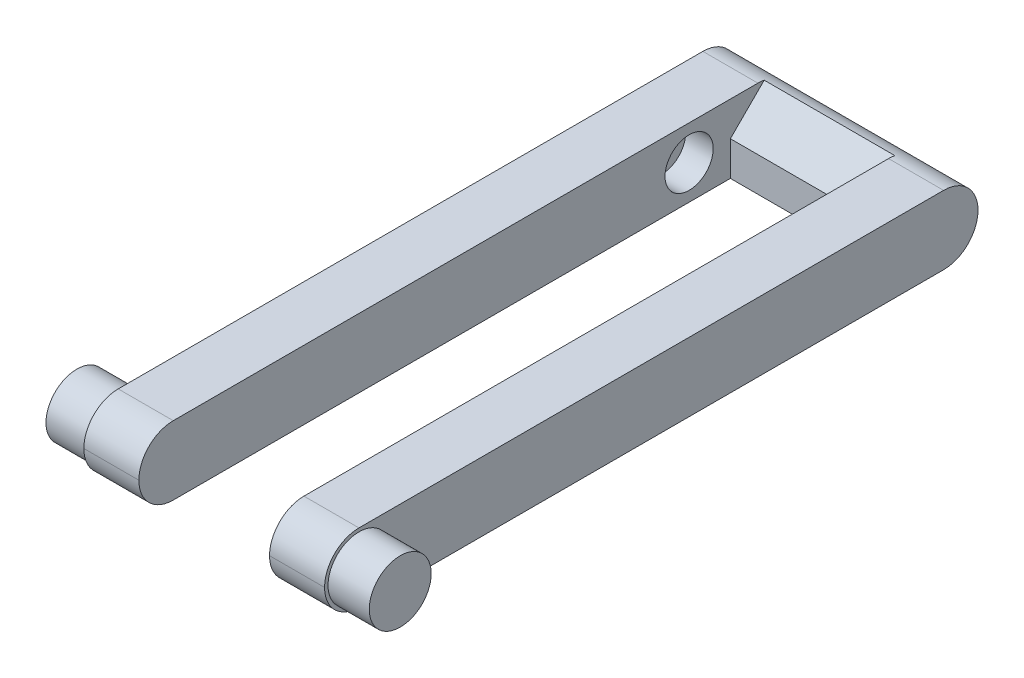
from build123d import *

# Parameters (mm, degrees)
BOSS_EXTRUDE1_DEPTH     = 5
SKETCH2_R               = 2.25
BOSS_EXTRUDE2_DEPTH     = 3
FILLET3_R               = 2.5
BOSS_EXTRUDE3_START     = 3
SKETCH3_R               = 2.25
BOSS_EXTRUDE3_DEPTH     = 3
FILLET4_R               = 2.5
CHAMFER1_START          = 4.949747468
CHAMFER1_OUTLINE_W      = 9.5
CHAMFER1_OUTLINE_H      = 3.535533906
CHAMFER1_DEPTH          = 3.050252532
FILLET5_R               = 2.5
CUT_EXTRUDE1_DEPTH      = 11.5
CUT_EXTRUDE1_DEPTH_BACK = 2
SKETCH4_R               = 1.75


with BuildPart() as part:
    # Sketch1 → Boss-Extrude1 (new body)
    with BuildSketch(Plane(origin=(0, 0, 0), x_dir=(1, 0, 0), z_dir=(0, 1, 0))):
        Polygon((17.5, 0), (0, 0), (0, -47.5), (4, -47.5), (4, -4.5), (13.5, -4.5), (13.5, -47.5), (17.5, -47.5), align=None)
    extrude(amount=BOSS_EXTRUDE1_DEPTH)

    # Sketch2 → Boss-Extrude2 (add)
    with BuildSketch(Plane(origin=(17.5, 0, 0), x_dir=(0, 0, -1), z_dir=(1, 0, 0))):
        with Locations((-45, 2.5)):
            Circle(SKETCH2_R)
    extrude(amount=BOSS_EXTRUDE2_DEPTH)

    # Fillet3
    fillet3_edges = [part.edges().sort_by_distance(p)[0] for p in [
        (15.5, 0, 47.5),
        (15.5, 5, 47.5),
    ]]
    fillet(fillet3_edges, radius=FILLET3_R - 0.0001)  # a hair under: the kernel refuses the full size

    # Sketch3 → Boss-Extrude3 (add)
    with BuildSketch(Plane.ZY.offset(BOSS_EXTRUDE3_START)):
        with Locations(Location((45, 2.5, 0), (0, 0, 180))):
            Circle(SKETCH3_R)
    extrude(amount=-BOSS_EXTRUDE3_DEPTH)

    # Fillet4
    fillet4_edges = [part.edges().sort_by_distance(p)[0] for p in [
        (2, 0, 47.5),
        (2, 5, 47.5),
    ]]
    fillet(fillet4_edges, radius=FILLET4_R - 0.0001)  # a hair under: the kernel refuses the full size

    # Chamfer1: read off the stored shape, not the designer's step
    # Chamfer1 outline → Chamfer1 (cut)
    with BuildSketch(Plane(origin=(0, 0, 0), x_dir=(1, 0, 0), z_dir=(0, 0.7071067811865476, 0.7071067811865476)).offset(CHAMFER1_START)):
        with Locations((8.75, 0.353553391)):
            Rectangle(CHAMFER1_OUTLINE_W, CHAMFER1_OUTLINE_H)
    extrude(amount=CHAMFER1_DEPTH, mode=Mode.SUBTRACT)

    # Fillet5
    # the kernel refuses this fillet: 2.5 mm, written as the material it takes off along each edge
    with BuildSketch(Plane(origin=(23.75, 0, 0), x_dir=(0, 0, 1), z_dir=(-1, 0, 0))) as fillet5_piece_1:
        with BuildLine():
            CenterArc((FILLET5_R, FILLET5_R), FILLET5_R, 180, 90)
            Line((0, FILLET5_R), (0, 0))
            Line((0, 0), (FILLET5_R, 0))
        make_face()
    extrude(amount=30, mode=Mode.SUBTRACT)
    with BuildSketch(Plane(origin=(23.75, 5, 0), x_dir=(0, 0, 1), z_dir=(-1, 0, 0))) as fillet5_piece_2:
        with BuildLine():
            CenterArc((FILLET5_R, -FILLET5_R), FILLET5_R, 90, 90)
            Line((0, -FILLET5_R), (0, 0))
            Line((0, 0), (FILLET5_R, 0))
        make_face()
    extrude(amount=30, mode=Mode.SUBTRACT)

    # Sketch4 → Cut-Extrude1 (cut, two sides: drawn at the far end of the back side and taken through both)
    with BuildSketch(Plane.ZY.offset(-13.5).offset(-CUT_EXTRUDE1_DEPTH_BACK)):
        with Locations((7.5, 2.5)):
            Circle(SKETCH4_R)
    extrude(amount=CUT_EXTRUDE1_DEPTH + CUT_EXTRUDE1_DEPTH_BACK, mode=Mode.SUBTRACT)


solid = part.part
